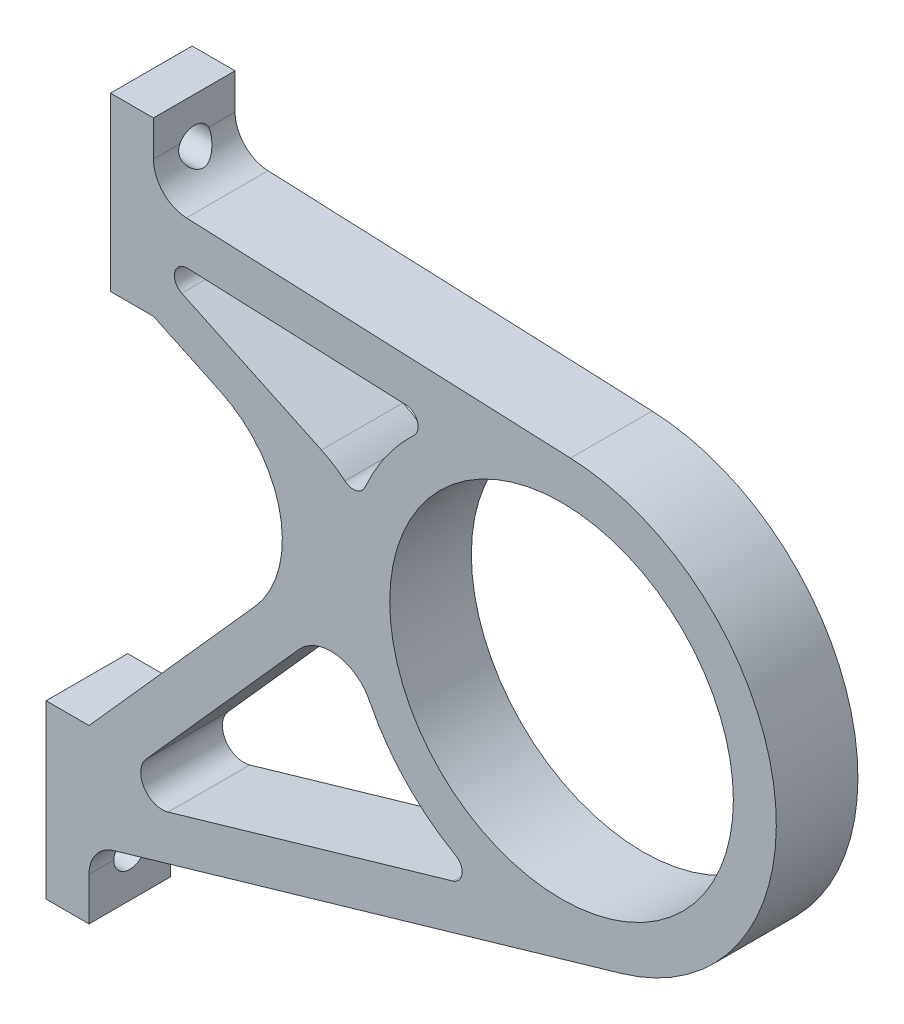
from build123d import *

# Parameters (mm, degrees)
SKETCH1_R           = 50.8
BOSS_EXTRUDE1_DEPTH = 24.13
FILLET1_R           = 10.16
SKETCH2_R           = 4.7625
CUT_EXTRUDE1_DEPTH  = 252.642736633


with BuildPart() as part:
    # Sketch1 → Boss-Extrude1 (new body)
    with BuildSketch(Plane.XY):
        with BuildLine():
            Line((-133.35, 88.9), (-133.35, 38.1))
            Line((-133.35, 38.1), (-120.65, 38.1))
            Line((-120.65, 38.1), (-100.755098441, 28.715816927))
            ThreePointArc((-100.755098441, 28.715816927), (-83.188973521, 6.337707108), (-90.601125221, -21.128791593))
            Line((-90.601125221, -21.128791593), (-139.7, -76.2))
            Line((-139.7, -76.2), (-152.4, -76.2))
            Line((-152.4, -76.2), (-152.4, -127))
            Line((-152.4, -127), (-139.7, -127))
            Line((-139.7, -127), (-139.7, -106.68))
            Line((-139.7, -106.68), (17.704429235, -60.981990665))
            ThreePointArc((17.704429235, -60.981990665), (63.039807772, 7.631031129), (2.642419241, 63.444996813))
            Line((2.642419241, 63.444996813), (-120.65, 68.58))
            Line((-120.65, 68.58), (-120.65, 88.9))
            Line((-120.65, 88.9), (-133.35, 88.9))
        make_face()
        Circle(SKETCH1_R, mode=Mode.SUBTRACT)
        with BuildLine():
            Line((-46.037431664, 52.76145265), (-110.49514893, 55.446050662))
            ThreePointArc((-110.49514893, 55.446050662), (-114.353417179, 52.549377789), (-112.279082271, 48.193452823))
            Line((-112.279082271, 48.193452823), (-70.985594525, 28.715816927))
            ThreePointArc((-70.985594525, 28.715816927), (-67.368742902, 26.71210826), (-64.042949916, 24.25536955))
            ThreePointArc((-64.042949916, 24.25536955), (-60.727043781, 23.453741785), (-58.09853243, 25.628314996))
            ThreePointArc((-58.09853243, 25.628314996), (-51.868282156, 36.632380569), (-43.581110206, 46.183729096))
            ThreePointArc((-43.581110206, 46.183729096), (-42.626724096, 50.287620053), (-46.037431664, 52.76145265))
        make_face(mode=Mode.SUBTRACT)
        with BuildLine():
            Line((-77.6210071, -25.653934719), (-122.808045193, -76.337474888))
            ThreePointArc((-122.808045193, -76.337474888), (-123.43951378, -83.950303149), (-116.297827314, -86.661432273))
            Line((-116.297827314, -86.661432273), (-32.118533433, -62.222309585))
            ThreePointArc((-32.118533433, -62.222309585), (-29.396609186, -59.006115837), (-31.302640742, -55.248481269))
            ThreePointArc((-31.302640742, -55.248481269), (-46.04089289, -43.731981225), (-56.784547657, -28.421209464))
            ThreePointArc((-56.784547657, -28.421209464), (-66.469460728, -21.515994345), (-77.6210071, -25.653934719))
        make_face(mode=Mode.SUBTRACT)
    extrude(amount=BOSS_EXTRUDE1_DEPTH)

    # Fillet1
    fillet1_edges = [part.edges().sort_by_distance(p)[0] for p in [
        (-139.7, -106.68, 12.065),
        (-120.65, 68.58, 12.065),
    ]]
    fillet(fillet1_edges, radius=FILLET1_R)

    # Sketch2 → Cut-Extrude1 (cut, through all)
    with BuildSketch(Plane.ZY.offset(152.4)):
        with Locations((12.065, -114.3)):
            Circle(SKETCH2_R)
        with Locations((12.065, 76.2)):
            Circle(SKETCH2_R)
    extrude(amount=-CUT_EXTRUDE1_DEPTH, mode=Mode.SUBTRACT)


solid = part.part
